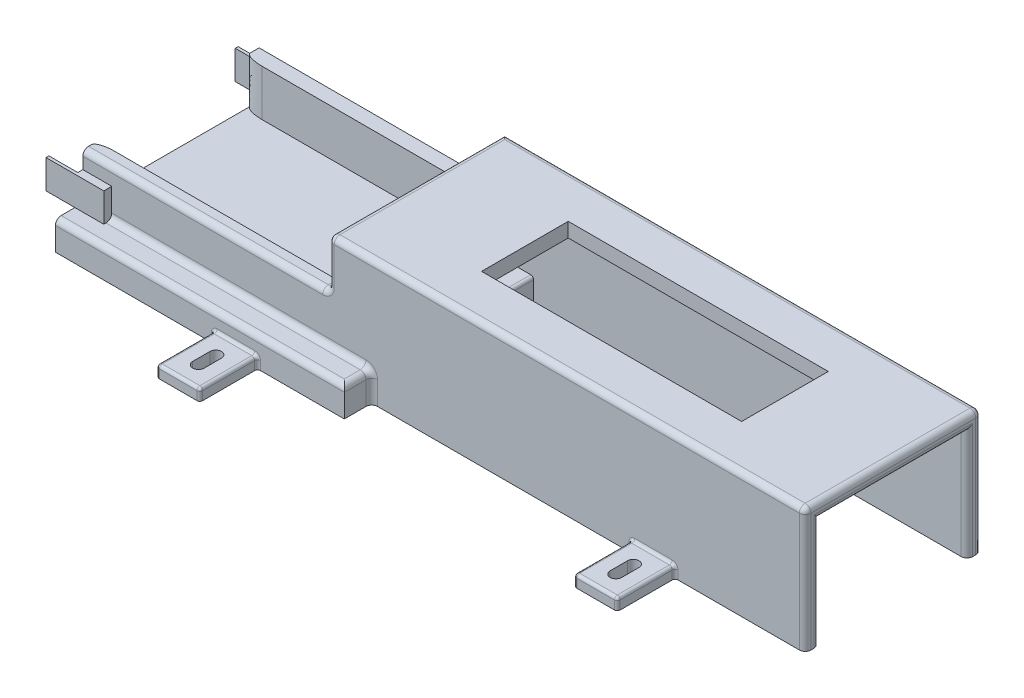
from build123d import *

# Parameters (mm, degrees)
SKETCH1_W                 = 100
SKETCH1_H                 = 80
BOSS_EXTRUDE1_DEPTH       = 5
BOSS_EXTRUDE2_DEPTH       = 15
BOSS_EXTRUDE4_DEPTH       = 150
SKETCH9_W                 = 85
SKETCH9_H                 = 5
BOSS_EXTRUDE5_DEPTH       = 16
SKETCH3_W                 = 15
SKETCH3_H                 = 20
BOSS_EXTRUDE3_DEPTH       = 4
F_4_0MM_START             = -5
F_4_0MM_DOWEL_SLOT1_DEPTH = 4
SKETCH12_W                = 2.75
SKETCH12_H                = 10
BOSS_EXTRUDE7_DEPTH       = 10
SKETCH13_W                = 1
SKETCH13_H                = 10
BOSS_EXTRUDE8_DEPTH       = 10
SKETCH14_W                = 90
SKETCH14_H                = 30
CUT_EXTRUDE1_DEPTH        = 214.187710715
FILLET2_R                 = 2
FILLET3_R                 = 1
FILLET4_SIZE              = 2
FILLET4_SIZE_2            = 6


# Read off the part's stored shape, not the designer's step: Ø4.0mm Dowel Slot1
with BuildPart() as part:
    # Sketch1 → Boss-Extrude1 (new, symmetric)
    with BuildSketch(Plane(origin=(0, 0, 0), x_dir=(1, 0, 0), z_dir=(0, 1, 0))):
        Rectangle(SKETCH1_W, SKETCH1_H)
    extrude(amount=BOSS_EXTRUDE1_DEPTH, both=True)

    # Sketch2 → Boss-Extrude2 (add)
    with BuildSketch(Plane(origin=(50, 0, 0), x_dir=(0, 0, -1), z_dir=(1, 0, 0))):
        Polygon((-30.5, 5), (-30.5, 38), (30.5, 38), (30.5, 5), (25.5, 5), (25.5, 33), (-25.5, 33), (-25.5, 5), align=None)
    extrude(amount=-BOSS_EXTRUDE2_DEPTH)

    # Sketch4 → Boss-Extrude4 (add)
    with BuildSketch(Plane(origin=(50, 0, 0), x_dir=(0, 0, -1), z_dir=(1, 0, 0))):
        Polygon((-30.5, 38), (30.5, 38), (30.5, -5), (25.5, -5), (25.5, 33), (-25.5, 33), (-25.5, -5), (-30.5, -5), align=None)
    extrude(amount=BOSS_EXTRUDE4_DEPTH)

    # Sketch9 → Boss-Extrude5 (add)
    with BuildSketch(Plane(origin=(0, 5, 0), x_dir=(1, 0, 0), z_dir=(0, 1, 0))):
        with Locations((-7.5, -28)):
            Rectangle(SKETCH9_W, SKETCH9_H)
        with Locations((-7.5, 28)):
            Rectangle(SKETCH9_W, SKETCH9_H)
    extrude(amount=BOSS_EXTRUDE5_DEPTH)

    # Sketch3 → Boss-Extrude3 (add)
    with BuildSketch(Plane.XZ.offset(5)):
        with Locations((12.5, 50)):
            Rectangle(SKETCH3_W, SKETCH3_H)
        with Locations((147.5, 40.5)):
            Rectangle(SKETCH3_W, SKETCH3_H)
        with Locations((147.5, -40.5)):
            Rectangle(SKETCH3_W, SKETCH3_H)
        with Locations((12.5, -50)):
            Rectangle(SKETCH3_W, SKETCH3_H)
    extrude(amount=-BOSS_EXTRUDE3_DEPTH)

    # Ø4.0mm Dowel Slot1 outline → Ø4.0mm Dowel Slot1 (cut)
    with BuildSketch(Plane(origin=(0, 0, 0), x_dir=(1, 0, 0), z_dir=(0, 1, 0)).offset(F_4_0MM_START)):
        with BuildLine():
            Line((149.5, 37.5), (149.5, 43.5))
            ThreePointArc((149.5, 43.5), (147.5, 45.5), (145.5, 43.5))
            Line((145.5, 43.5), (145.5, 37.5))
            ThreePointArc((145.5, 37.5), (147.5, 35.5), (149.5, 37.5))
        make_face()
        with BuildLine():
            ThreePointArc((149.5, -37.5), (147.5, -35.5), (145.5, -37.5))
            Line((145.5, -37.5), (145.5, -43.5))
            ThreePointArc((145.5, -43.5), (147.5, -45.5), (149.5, -43.5))
            Line((149.5, -43.5), (149.5, -37.5))
        make_face()
        with BuildLine():
            Line((14.5, -53), (14.5, -47))
            ThreePointArc((14.5, -47), (12.5, -45), (10.5, -47))
            Line((10.5, -47), (10.5, -53))
            ThreePointArc((10.5, -53), (12.5, -55), (14.5, -53))
        make_face()
        with BuildLine():
            ThreePointArc((14.5, 53), (12.5, 55), (10.5, 53))
            Line((10.5, 53), (10.5, 47))
            ThreePointArc((10.5, 47), (12.5, 45), (14.5, 47))
            Line((14.5, 47), (14.5, 53))
        make_face()
    extrude(amount=F_4_0MM_DOWEL_SLOT1_DEPTH, mode=Mode.SUBTRACT)

    # Sketch12 → Boss-Extrude7 (add)
    with BuildSketch(Plane.ZY.offset(50)):
        with Locations((-31.875, 10)):
            Rectangle(SKETCH12_W, SKETCH12_H)
        with Locations((31.875, 10)):
            Rectangle(SKETCH12_W, SKETCH12_H)
    extrude(amount=-BOSS_EXTRUDE7_DEPTH)

    # Sketch13 → Boss-Extrude8 (add)
    with BuildSketch(Plane.ZY.offset(50)):
        with Locations((32.75, 10)):
            Rectangle(SKETCH13_W, SKETCH13_H)
        with Locations((-32.75, 10)):
            Rectangle(SKETCH13_W, SKETCH13_H)
    extrude(amount=BOSS_EXTRUDE8_DEPTH)

    # Sketch14 → Cut-Extrude1 (cut, through all)
    with BuildSketch(Plane(origin=(0, 38, 0), x_dir=(1, 0, 0), z_dir=(0, 1, 0))):
        with Locations((117.5, 0)):
            Rectangle(SKETCH14_W, SKETCH14_H)
    extrude(amount=-CUT_EXTRUDE1_DEPTH, mode=Mode.SUBTRACT)

    # Fillet2
    fillet2_edges = [part.edges().sort_by_distance(p)[0] for p in [
        (0, 5, 40),
        (50, 5, -35.25),
        (5, 5, -30.5),
        (5, 5, 30.5),
        (35, 29.5, 30.5),
        (35, 38, 0),
        (117.5, 38, 30.5),
        (117.5, 38, -30.5),
        (50, 0, 30.5),
        (50, 0, -30.5),
        (50, 5, 35.25),
        (200, 16.5, 30.5),
        (200, 14, 25.5),
        (200, 33, 0),
        (200, 14, -25.5),
        (200, 16.5, -30.5),
        (200, 38, 0),
        (35, 21, 28),
        (-7.5, 21, 30.5),
        (0, 5, -40),
    ]]
    fillet(fillet2_edges, radius=FILLET2_R)

    # Fillet3
    fillet3_edges = [part.edges().sort_by_distance(p)[0] for p in [
        (20, -1, 50),
        (20, -3, 60),
        (12.5, -1, 40),
        (20, -3, 40),
        (5, -1, 50),
        (5, -3, 40),
        (12.5, -1, 60),
        (5, -3, 60),
        (140, -1, 40.5),
        (140, -3, 30.5),
        (147.5, -1, 50.5),
        (140, -3, 50.5),
        (155, -1, 40.5),
        (155, -3, 50.5),
        (147.5, -1, 30.5),
        (155, -3, 30.5),
        (147.5, -1, -30.5),
        (140, -3, -30.5),
        (155, -1, -40.5),
        (155, -3, -30.5),
        (147.5, -1, -50.5),
        (155, -3, -50.5),
        (140, -1, -40.5),
        (140, -3, -50.5),
        (12.5, -1, -40),
        (5, -3, -40),
        (20, -1, -50),
        (20, -3, -40),
        (12.5, -1, -60),
        (20, -3, -60),
        (5, -1, -50),
        (5, -3, -60),
        (50, 5, 0),
    ]]
    fillet(fillet3_edges, radius=FILLET3_R)

    # Fillet4
    # an asymmetric fillet: 6, 2 mm, written as the material it takes off along each edge
    with BuildSketch(Plane(origin=(-50, 5, 25.5), x_dir=(0, 0, 1), z_dir=(0, 1, 0))) as fillet4_piece_1:
        with BuildLine():
            Bezier((FILLET4_SIZE, 0), (0, 0), (0, FILLET4_SIZE_2), weights=[1, 0.707106781, 1])
            Line((0, FILLET4_SIZE_2), (0, 0))
            Line((0, 0), (FILLET4_SIZE, 0))
        make_face()
    extrude(amount=31, mode=Mode.SUBTRACT)
    with BuildSketch(Plane(origin=(-50, 5, -25.5), x_dir=(0, 0, -1), z_dir=(0, 1, 0))) as fillet4_piece_2:
        with BuildLine():
            Bezier((FILLET4_SIZE, 0), (0, 0), (0, -FILLET4_SIZE_2), weights=[1, 0.707106781, 1])
            Line((0, -FILLET4_SIZE_2), (0, 0))
            Line((0, 0), (FILLET4_SIZE, 0))
        make_face()
    extrude(amount=31, mode=Mode.SUBTRACT)


solid = part.part
